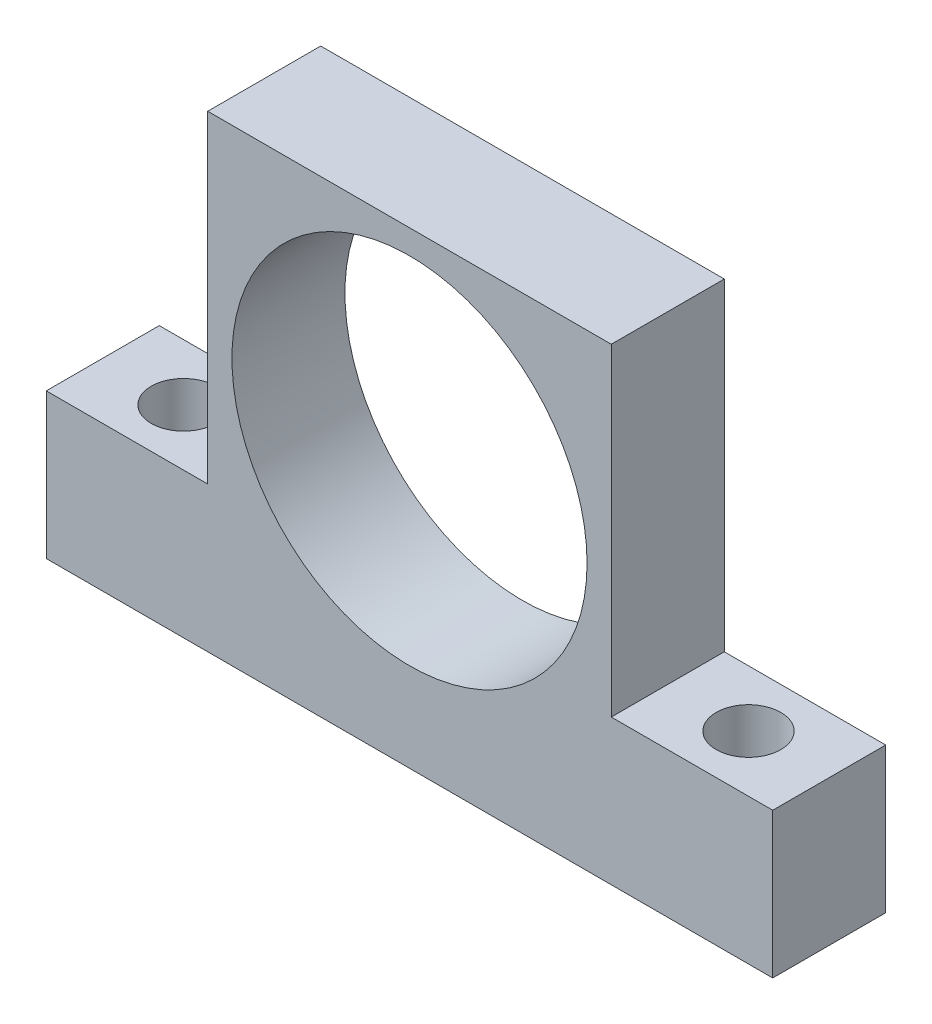
from build123d import *

# Parameters (mm, degrees)
SKETCH1_R           = 11
BOSS_EXTRUDE1_DEPTH = 7
SKETCH2_R           = 2
CUT_EXTRUDE1_DEPTH  = 9


with BuildPart() as part:
    # Sketch1 → Boss-Extrude1 (new body)
    with BuildSketch(Plane.XY):
        Polygon((12.5, 12.5), (-12.5, 12.5), (-12.5, -7.5), (-22.5, -7.5), (-22.5, -16.5), (22.5, -16.5), (22.5, -7.5), (12.5, -7.5), align=None)
        Circle(SKETCH1_R, mode=Mode.SUBTRACT)
    extrude(amount=BOSS_EXTRUDE1_DEPTH)

    # Sketch2 → Cut-Extrude1 (cut)
    with BuildSketch(Plane(origin=(0, -7.5, 0), x_dir=(1, 0, 0), z_dir=(0, 1, 0))):
        with Locations((-17.5, -3.5)):
            Circle(SKETCH2_R)
        with Locations((17.5, -3.5)):
            Circle(SKETCH2_R)
    extrude(amount=-CUT_EXTRUDE1_DEPTH, mode=Mode.SUBTRACT)


solid = part.part
